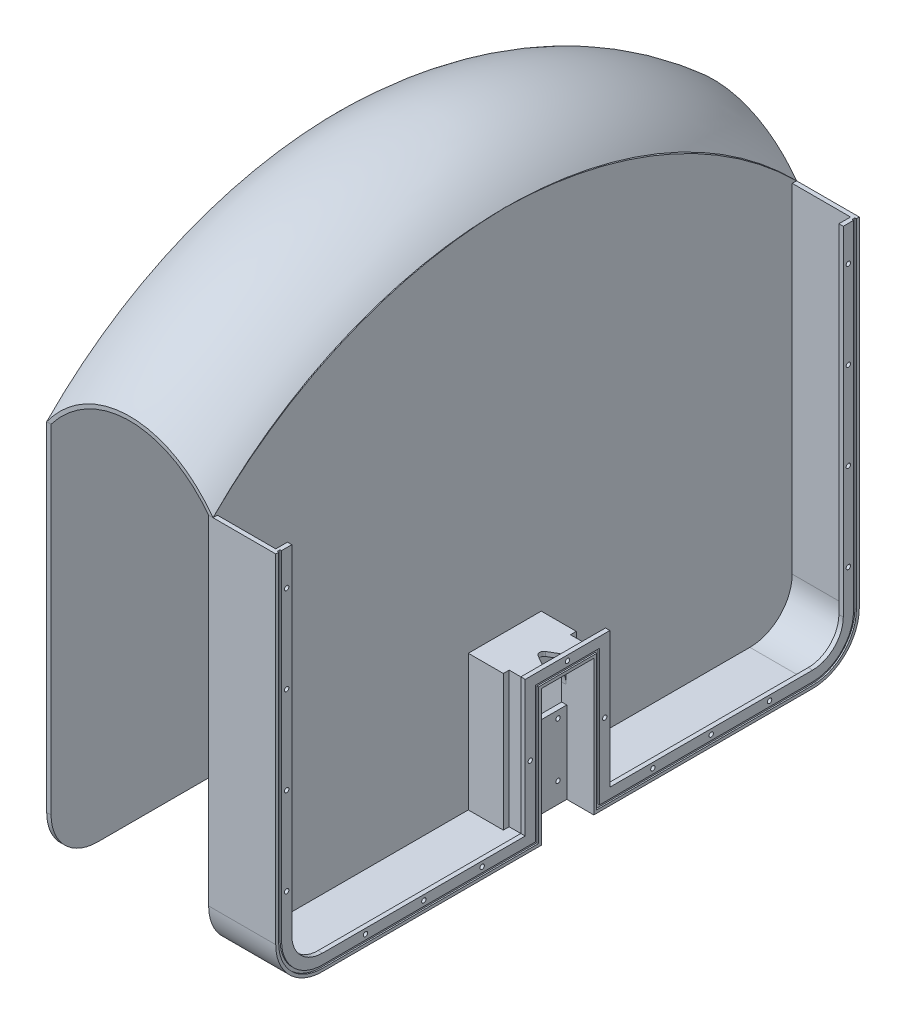
from build123d import *

# Parameters (mm, degrees)
SKETCH1_W            = 17.399999779
SKETCH1_H            = 44
SKETCH1_W_2          = 4.00000019
SKETCH1_W_3          = 2.600000031
BOSS_EXTRUDE1_DEPTH  = 3
SKETCH2_W            = 24
SKETCH2_H            = 3
BOSS_EXTRUDE2_DEPTH  = 93.000002671
FILLET1_R            = 4
CUT_EXTRUDE3_DEPTH   = 78.317529386
SKETCH4_W            = 3
SKETCH4_H            = 96.000002671
BOSS_EXTRUDE5_DEPTH  = 263
SKETCH6_W            = 3
SKETCH6_H            = 288
BOSS_EXTRUDE6_DEPTH  = 363
CUT_EXTRUDE4_DEPTH   = 487.210859684
REVOLVE1_ANGLE       = 91.169383
MIRROR6_START        = -216.449601032
MIRROR6_OUTLINE_W    = 118
MIRROR6_OUTLINE_H    = 35
MIRROR6_DEPTH        = 16.449601032
BOSS_EXTRUDE7_DEPTH  = 43
SKETCH13_W           = 19
SKETCH13_H           = 3
BOSS_EXTRUDE8_DEPTH  = 7
SKETCH14_W           = 19
SKETCH14_H           = 3
BOSS_EXTRUDE9_DEPTH  = 93.000002671
SKETCH15_W           = 19
SKETCH15_H           = 3
BOSS_EXTRUDE10_DEPTH = 18
BOSS_EXTRUDE11_DEPTH = 3
CUT_EXTRUDE5_DEPTH   = 3
BOSS_EXTRUDE12_REACH = 388.459
SKETCH24_R           = 1.5
CUT_EXTRUDE6_DEPTH   = 3.491933385
SEAL_CUT_DEPTH       = 1
SKETCH26_R           = 1.5
CUT_EXTRUDE9_DEPTH   = 3
SKETCH27_R           = 1.5
CUT_EXTRUDE10_DEPTH  = 3


# Read off the part's stored shape, not the designer's step: Revolve1, Mirror6
with BuildPart() as part:
    # Sketch1 → Boss-Extrude1 (new body)
    with BuildSketch(Plane(origin=(0, 25.000000095, 0), x_dir=(1, 0, 0), z_dir=(0, 1, 0))):
        Polygon((54, 25), (54, 22), (56.600000031, 22), (73.99999981, 22), (78, 22), (78, 25), align=None)
        with Locations((65.29999992, 0)):
            Rectangle(SKETCH1_W, SKETCH1_H)
        with Locations((75.999999905, 0)):
            Rectangle(SKETCH1_W_2, SKETCH1_H)
        with Locations((55.300000016, 0)):
            Rectangle(SKETCH1_W_3, SKETCH1_H)
        Polygon((81, 25), (78, 25), (78, 22), (78, -22), (78, -25), (81, -25), align=None)
        Polygon((56.600000031, -22), (54, -22), (54, -25), (78, -25), (78, -22), (73.99999981, -22), align=None)
    extrude(amount=BOSS_EXTRUDE1_DEPTH)

    # Sketch2 → Boss-Extrude2 (add)
    with BuildSketch(Plane.XZ.offset(-25.000000095)):
        with Locations((66, 23.5)):
            Rectangle(SKETCH2_W, SKETCH2_H)
        Polygon((81, -25), (81, 25), (78, 25), (78, 22), (78, -22), (78, -25), align=None)
        with Locations((66, -23.5)):
            Rectangle(SKETCH2_W, SKETCH2_H)
    extrude(amount=BOSS_EXTRUDE2_DEPTH)

    # Fillet1
    # the kernel refuses this fillet: 4 mm, written as the material it takes off along each edge
    with BuildSketch(Plane(origin=(78, -68.000002576, -22), x_dir=(0, 1, 0), z_dir=(0, 0, 1))) as fillet1_piece_1:
        with BuildLine():
            CenterArc((FILLET1_R, -FILLET1_R), FILLET1_R, 90, 90)
            Line((0, -FILLET1_R), (0, 0))
            Line((0, 0), (FILLET1_R, 0))
        make_face()
    extrude(amount=44, mode=Mode.SUBTRACT)

    # Sketch3 → Cut-Extrude3 (cut, through all)
    with BuildSketch(Plane(origin=(81, 0, 0), x_dir=(0, 0, -1), z_dir=(1, 0, 0))):
        with BuildLine():
            Line((-18, 0), (-18, -67.872985922))
            Line((-18, -67.872985922), (25, -68.000002576))
            Line((25, -68.000002576), (25, 28.000000095))
            Line((25, 28.000000095), (0, 28.000000095))
            Line((0, 28.000000095), (0, 18))
            ThreePointArc((0, 18), (-12.727922061, 12.727922061), (-18, 0))
        make_face()
    extrude(amount=-CUT_EXTRUDE3_DEPTH, mode=Mode.SUBTRACT)


with BuildPart() as cut_extrude3_piece_1:
    # of the separate pieces the step leaves, piece 1, a body of its own (cut_extrude3_pieces)
    add(part.part.solids().sort_by_distance((54, 28.000000095, 0))[0])

    # Sketch4 → Boss-Extrude5 (add)
    with BuildSketch(Plane.XY.offset(25)):
        with Locations((55.5, -20.00000124)):
            Rectangle(SKETCH4_W, SKETCH4_H)
    extrude(amount=BOSS_EXTRUDE5_DEPTH)

    # Sketch6 → Boss-Extrude6 (add)
    with BuildSketch(Plane(origin=(0, 28.000000095, 0), x_dir=(1, 0, 0), z_dir=(0, 1, 0))):
        with Locations((55.5, -144)):
            Rectangle(SKETCH6_W, SKETCH6_H)
    extrude(amount=BOSS_EXTRUDE6_DEPTH)

    # Sketch8 → Cut-Extrude4 (cut, through all)
    with BuildSketch(Plane(origin=(57, 0, 0), x_dir=(0, 0, -1), z_dir=(1, 0, 0))):
        with BuildLine():
            Line((-200, 195.959179423), (-200, -36.000002576))
            ThreePointArc((-200, -36.000002576), (-190.627416998, -58.627419574), (-168, -68.000002576))
            Line((-168, -68.000002576), (-288, -68.000002576))
            Line((-288, -68.000002576), (-288, 391.000000095))
            Line((-288, 391.000000095), (0, 391.000000095))
            Line((0, 391.000000095), (0, 280))
            ThreePointArc((0, 280), (-108.154479105, 257.385585628), (-200, 195.959179423))
        make_face()
    extrude(amount=-CUT_EXTRUDE4_DEPTH, mode=Mode.SUBTRACT)

    # Mirror4: Cut-Extrude3 piece 1 across plane


with BuildPart() as cut_extrude3_piece_2:
    # of the separate pieces the step leaves, piece 2, a body of its own (cut_extrude3_pieces)
    add(part.part.solids().sort_by_distance((54, -68.000002576, -22))[0])


with BuildPart() as cut_extrude3_piece_1_1:
    add(cut_extrude3_piece_1.part)
    add(cut_extrude3_piece_1.part.mirror(Plane.XY))


with BuildPart() as body_3:
    # Mirror5: mirrored copy
    add(cut_extrude3_piece_1_1.part.mirror(Plane(origin=(0, 0, 0), x_dir=(0, 0, 1), z_dir=(1, 0, 0))))


with BuildPart() as body_4:
    # Revolve1 outline → Revolve1 (revolve)
    with BuildSketch(Plane(origin=(0, 0, 0), x_dir=(0, 0.6998542122237648, -0.7142857142857147), z_dir=(0, -0.7142857142857147, -0.6998542122237648))):
        with BuildLine():
            Line((280, 57), (280, 54))
            ThreePointArc((280, 54), (300.974581747, 0), (280, -54))
            Line((280, -54), (280, -57))
            ThreePointArc((280, -57), (303.029441444, 0), (280, 57))
        make_face()
    revolve(axis=Axis((0, 0, 0), (1, 0, 0)), revolution_arc=REVOLVE1_ANGLE)

    # SurfaceCut1
    split(bisect_by=Plane.XY.offset(200), keep=Keep.BOTTOM)

    # Mirror6 outline → Mirror6 (cut)
    with BuildSketch(Plane.XY.offset(MIRROR6_START)):
        with Locations((0, 211.5)):
            Rectangle(MIRROR6_OUTLINE_W, MIRROR6_OUTLINE_H)
    extrude(amount=MIRROR6_DEPTH, mode=Mode.SUBTRACT)


with BuildPart() as cut_extrude3_piece_1_2:
    add(cut_extrude3_piece_1_1.part)

    # Sketch11 → Boss-Extrude7 (add)
    with BuildSketch(Plane(origin=(57, 0, 0), x_dir=(0, 0, -1), z_dir=(1, 0, 0))):
        with BuildLine():
            Line((-197, 195.959179423), (-197, -36.000002576))
            ThreePointArc((-197, -36.000002576), (-188.506096654, -56.50609923), (-168, -65.000002576))
            Line((-168, -65.000002576), (-25, -65.000002576))
            Line((-25, -65.000002576), (-25, -68.000002576))
            Line((-25, -68.000002576), (-168, -68.000002576))
            ThreePointArc((-168, -68.000002576), (-190.627416998, -58.627419574), (-200, -36.000002576))
            Line((-200, -36.000002576), (-200, 195.959179423))
            Line((-200, 195.959179423), (-197, 195.959179423))
        make_face()
    boss_extrude7 = extrude(amount=BOSS_EXTRUDE7_DEPTH)

    # Sketch13 → Boss-Extrude8 (add)
    with BuildSketch(Plane(origin=(0, 0, 25), x_dir=(-1, 0, 0), z_dir=(0, 0, -1))):
        with Locations((-90.5, -66.500002576)):
            Rectangle(SKETCH13_W, SKETCH13_H)
    boss_extrude8 = extrude(amount=BOSS_EXTRUDE8_DEPTH)

    # Sketch14 → Boss-Extrude9 (add)
    with BuildSketch(Plane(origin=(0, -65.000002576, 0), x_dir=(1, 0, 0), z_dir=(0, 1, 0))):
        with Locations((90.5, -19.5)):
            Rectangle(SKETCH14_W, SKETCH14_H)
    boss_extrude9 = extrude(amount=BOSS_EXTRUDE9_DEPTH)

    # Sketch15 → Boss-Extrude10 (add)
    with BuildSketch(Plane(origin=(0, 0, 18), x_dir=(-1, 0, 0), z_dir=(0, 0, -1))):
        with Locations((-90.5, 26.500000095)):
            Rectangle(SKETCH15_W, SKETCH15_H)
    boss_extrude10 = extrude(amount=BOSS_EXTRUDE10_DEPTH)

    # Mirror7: Boss-Extrude7, Boss-Extrude8, Boss-Extrude9, Boss-Extrude10 across plane
    add(boss_extrude7.mirror(Plane.XY))
    add(boss_extrude8.mirror(Plane.XY))
    add(boss_extrude9.mirror(Plane.XY))
    add(boss_extrude10.mirror(Plane.XY))

    # Sketch18 → Boss-Extrude11 (add)
    with BuildSketch(Plane(origin=(100, 0, 0), x_dir=(0, 0, -1), z_dir=(1, 0, 0))):
        with BuildLine():
            Line((21, -65.000002576), (168, -65.000002576))
            ThreePointArc((168, -65.000002576), (188.506096654, -56.50609923), (197, -36.000002576))
            Line((197, -36.000002576), (197, 195.959179423))
            Line((197, 195.959179423), (189, 195.959179423))
            Line((189, 195.959179423), (189, -36.000002576))
            ThreePointArc((189, -36.000002576), (182.849242405, -50.849244981), (168, -57.000002576))
            Line((168, -57.000002576), (29, -57.000002576))
            Line((29, -57.000002576), (29, 28.000000095))
            Line((29, 28.000000095), (29, 36.000000095))
            Line((29, 36.000000095), (0, 36.000000095))
            Line((0, 36.000000095), (0, 28.000000095))
            Line((0, 28.000000095), (21, 28.000000095))
            Line((21, 28.000000095), (21, -65.000002576))
        make_face()
    boss_extrude11 = extrude(amount=-BOSS_EXTRUDE11_DEPTH)

    # mt60 hole → Cut-Extrude5 (cut)
    with BuildSketch(Plane(origin=(0, 28.000000095, 0), x_dir=(1, 0, 0), z_dir=(0, 1, 0))):
        with BuildLine():
            Line((93, -3.5), (93, 3.5))
            ThreePointArc((93, 3.5), (91.5, 6.098076211), (88.5, 6.098076211))
            Line((88.5, 6.098076211), (82.437822174, 2.598076211))
            ThreePointArc((82.437822174, 2.598076211), (80.937822174, 0), (82.437822174, -2.598076211))
            Line((82.437822174, -2.598076211), (88.5, -6.098076211))
            ThreePointArc((88.5, -6.098076211), (91.5, -6.098076211), (93, -3.5))
        make_face()
    extrude(amount=-CUT_EXTRUDE5_DEPTH, mode=Mode.SUBTRACT)

    # Sketch23 → Boss-Extrude12 (add, up to next)
    with BuildSketch(Plane(origin=(0, 0, 18), x_dir=(-1, 0, 0), z_dir=(0, 0, -1)), mode=Mode.PRIVATE) as boss_extrude12_sk1:
        with BuildLine():
            Line((-81.491933385, -65.951002636), (-81.491933385, -68.000002576))
            Line((-81.491933385, -68.000002576), (-81, -67.872985922))
            ThreePointArc((-81, -67.872985922), (-78.83772234, -66.449492319), (-78, -64.000002576))
            Line((-78, -64.000002576), (-78, -11.951002636))
            Line((-78, -11.951002636), (-81.491933385, -11.951002636))
            Line((-81.491933385, -11.951002636), (-81.491933385, -65.951002636))
        make_face()
    boss_extrude12_tool1 = extrude(boss_extrude12_sk1.sketch, amount=BOSS_EXTRUDE12_REACH, mode=Mode.PRIVATE) - cut_extrude3_piece_1_2.part
    add(boss_extrude12_tool1.solids().sort_by_distance((79.761287, -39.49263, 18))[0])

    # Sketch24 → Cut-Extrude6 (cut)
    with BuildSketch(Plane(origin=(81.491933385, 0, 0), x_dir=(0, 0, -1), z_dir=(1, 0, 0))):
        with Locations(Location((-12, -54.000002576, 0), (0, 0, 90))):
            Circle(SKETCH24_R)
        with Locations(Location((12, -54.000002576, 0), (0, 0, 90))):
            Circle(SKETCH24_R)
        with Locations(Location((-12, -16.951002636, 0), (0, 0, 90))):
            Circle(SKETCH24_R)
        with Locations(Location((12, -16.951002636, 0), (0, 0, 90))):
            Circle(SKETCH24_R)
    extrude(amount=-CUT_EXTRUDE6_DEPTH, mode=Mode.SUBTRACT)

    # Sketch25 → seal cut (cut)
    with BuildSketch(Plane(origin=(100, 0, 0), x_dir=(0, 0, -1), z_dir=(1, 0, 0))):
        with BuildLine():
            Line((196, 195.959179423), (196, -36.000002576))
            ThreePointArc((196, -36.000002576), (187.798989873, -55.798992449), (168, -64.000002576))
            Line((168, -64.000002576), (22, -64.000002576))
            Line((22, -64.000002576), (22, 25.000000095))
            Line((22, 25.000000095), (22, 29.000000095))
            Line((22, 29.000000095), (0, 29.000000095))
            Line((0, 29.000000095), (0, 27.000000095))
            Line((0, 27.000000095), (20, 27.000000095))
            Line((20, 27.000000095), (20, 25.000000095))
            Line((20, 25.000000095), (20, -66.000002576))
            Line((20, -66.000002576), (168, -66.000002576))
            ThreePointArc((168, -66.000002576), (189.213203436, -57.213206012), (198, -36.000002576))
            Line((198, -36.000002576), (198, 195.959179423))
            Line((198, 195.959179423), (196, 195.959179423))
        make_face()
    seal_cut = extrude(amount=-SEAL_CUT_DEPTH, mode=Mode.SUBTRACT)

    # Sketch26 → Cut-Extrude9 (cut)
    with BuildSketch(Plane(origin=(100, 0, 0), x_dir=(0, 0, -1), z_dir=(1, 0, 0))):
        with Locations(Location((192.5, 171.959179423, 0), (0, 0, 90))):
            Circle(SKETCH26_R)
        with Locations(Location((192.5, 111.959179423, 0), (0, 0, 90))):
            Circle(SKETCH26_R)
        with Locations(Location((192.5, 51.959179423, 0), (0, 0, 90))):
            Circle(SKETCH26_R)
        with Locations(Location((192.5, -8.040820577, 0), (0, 0, 90))):
            Circle(SKETCH26_R)
        with Locations(Location((98.5, -60.500002576, 0), (0, 0, 90))):
            Circle(SKETCH26_R)
        with Locations(Location((138.5, -60.500002576, 0), (0, 0, 90))):
            Circle(SKETCH26_R)
        with Locations(Location((58.5, -60.500002576, 0), (0, 0, 90))):
            Circle(SKETCH26_R)
        with Locations(Location((25.5, -14.000001241, 0), (0, 0, 90))):
            Circle(SKETCH26_R)
    cut_extrude9 = extrude(amount=-CUT_EXTRUDE9_DEPTH, mode=Mode.SUBTRACT)

    # Mirror8: Boss-Extrude11, seal cut, Cut-Extrude9 across plane
    add(boss_extrude11.mirror(Plane.XY))
    add(seal_cut.mirror(Plane.XY), mode=Mode.SUBTRACT)
    add(cut_extrude9.mirror(Plane.XY), mode=Mode.SUBTRACT)

    # Sketch27 → Cut-Extrude10 (cut)
    with BuildSketch(Plane(origin=(100, 0, 0), x_dir=(0, 0, -1), z_dir=(1, 0, 0))):
        with Locations(Location((0, 32.500000095, 0), (0, 0, 90))):
            Circle(SKETCH27_R)
    extrude(amount=-CUT_EXTRUDE10_DEPTH, mode=Mode.SUBTRACT)


solid = Compound([cut_extrude3_piece_2.part, body_3.part, body_4.part, cut_extrude3_piece_1_2.part])
